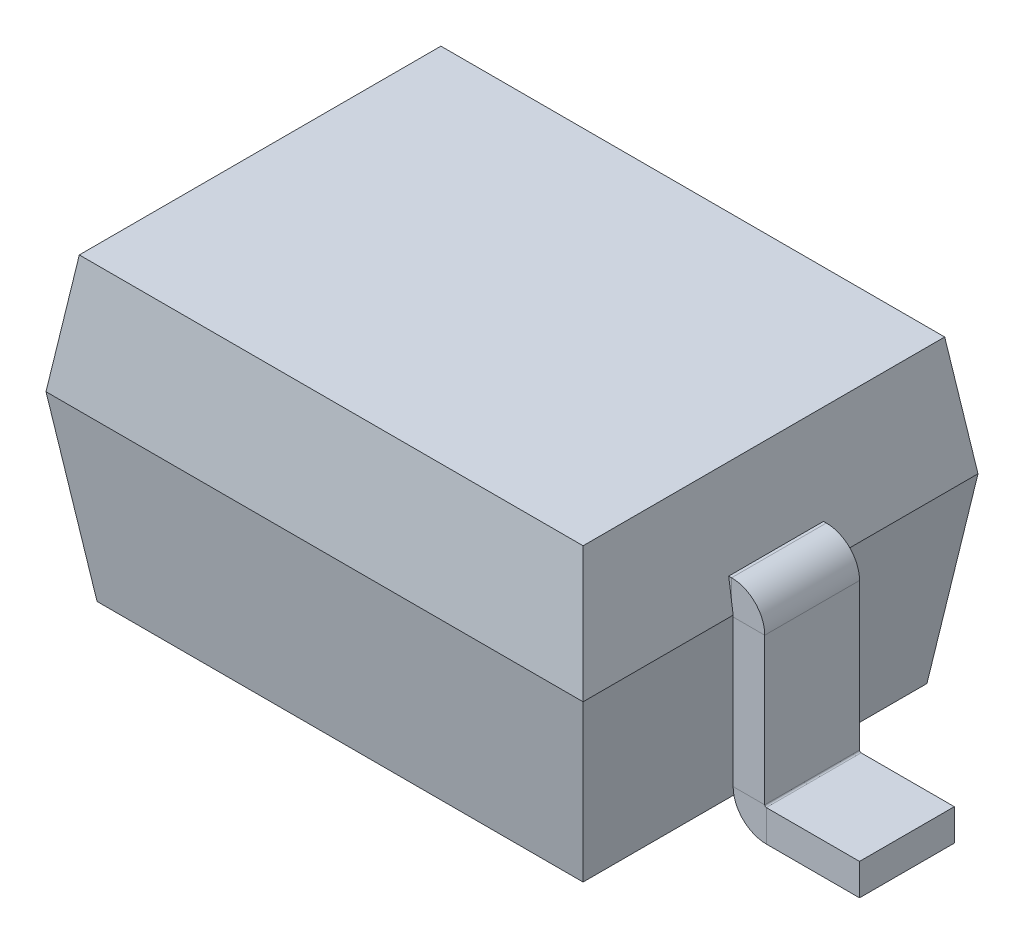
from build123d import *

# Parameters (mm, degrees)
SKETCH1_W                     = 1.7
SKETCH1_H                     = 1.25
BOSS_EXTRUDE1_DEPTH           = 0.375
BOSS_EXTRUDE1_TAPER           = 8
BOSS_EXTRUDE1_OTHER_WAY_DEPTH = 0.575
BOSS_EXTRUDE1_OTHER_WAY_TAPER = 8
BASE_FLANGE1_DEPTH            = 0.15


# Sheet-metal steps are written as plain solids
with BuildPart() as part:
    # Sketch1 → Boss-Extrude1 (new body)
    with BuildSketch(Plane(origin=(0, 0, 0), x_dir=(1, 0, 0), z_dir=(0, 1, 0))):
        Rectangle(SKETCH1_W, SKETCH1_H)
    extrude(amount=BOSS_EXTRUDE1_DEPTH, taper=BOSS_EXTRUDE1_TAPER)

    # Sketch1 → Boss-Extrude1 other way (add)
    with BuildSketch(Plane(origin=(0, 0, 0), x_dir=(1, 0, 0), z_dir=(0, 1, 0))):
        Rectangle(SKETCH1_W, SKETCH1_H)
    extrude(amount=-BOSS_EXTRUDE1_OTHER_WAY_DEPTH, taper=BOSS_EXTRUDE1_OTHER_WAY_TAPER)


with BuildPart() as body_2:
    # Sketch2 → Base-Flange1 (new, symmetric)
    with BuildSketch(Plane.XY):
        with BuildLine():
            Line((0.801508234, 0), (0.845, 0))
            ThreePointArc((0.845, 0), (0.848535534, -0.001464466), (0.85, -0.005))
            Line((0.85, -0.005), (0.85, -0.47))
            ThreePointArc((0.85, -0.47), (0.880753788, -0.544246212), (0.955, -0.575))
            Line((0.955, -0.575), (1.25, -0.575))
            Line((1.25, -0.575), (1.25, -0.475))
            Line((1.25, -0.475), (0.955, -0.475))
            ThreePointArc((0.955, -0.475), (0.951464466, -0.473535534), (0.95, -0.47))
            Line((0.95, -0.47), (0.95, -0.005))
            ThreePointArc((0.95, -0.005), (0.919246212, 0.069246212), (0.845, 0.1))
            Line((0.845, 0.1), (0.801508234, 0.1))
            Line((0.801508234, 0.1), (0.801508234, 0))
        make_face()
    extrude(amount=BASE_FLANGE1_DEPTH, both=True)


with BuildPart() as body_3:
    # Mirror1: mirrored copy
    add(body_2.part.mirror(Plane.ZY))


solid = Compound([part.part, body_2.part, body_3.part])
